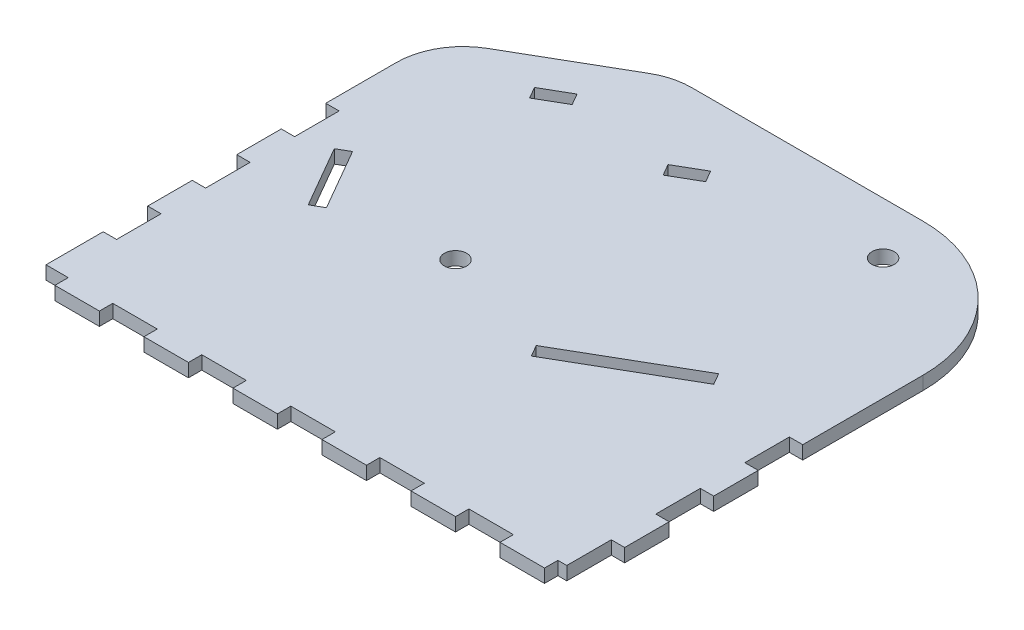
from build123d import *

# Parameters (mm, degrees)
CROQUIS1_R              = 2.5
SALIENTE_EXTRUIR1_DEPTH = 3


with BuildPart() as part:
    # Croquis1 → Saliente-Extruir1 (new body)
    with BuildSketch(Plane(origin=(0, 0, 0), x_dir=(1, 0, 0), z_dir=(0, 1, 0))):
        with BuildLine():
            Line((5, 3), (5, 0))
            Line((5, 0), (15, 0))
            Line((15, 0), (15, 3))
            Line((15, 3), (25, 3))
            Line((25, 3), (25, 0))
            Line((25, 0), (35, 0))
            Line((35, 0), (35, 3))
            Line((35, 3), (45, 3))
            Line((45, 3), (45, 0))
            Line((45, 0), (55, 0))
            Line((55, 0), (55, 3))
            Line((55, 3), (60, 3))
            Line((60, 3), (65, 3))
            Line((65, 3), (65, 0))
            Line((65, 0), (75, 0))
            Line((75, 0), (75, 3))
            Line((75, 3), (85, 3))
            Line((85, 3), (85, 0))
            Line((85, 0), (92.72, 0))
            Line((92.72, 0), (95, 0))
            Line((95, 0), (95, 3))
            Line((95, 3), (105, 3))
            Line((105, 3), (105, 0))
            Line((105, 0), (115, 0))
            Line((115, 0), (115, 3))
            Line((115, 3), (117, 3))
            Line((117, 3), (117, 13))
            Line((117, 13), (120, 13))
            Line((120, 13), (120, 23))
            Line((120, 23), (117, 23))
            Line((117, 23), (117, 33))
            Line((117, 33), (120, 33))
            Line((120, 33), (120, 43))
            Line((120, 43), (117, 43))
            Line((117, 43), (117, 53))
            Line((117, 53), (120, 53))
            Line((120, 53), (120, 80))
            ThreePointArc((120, 80), (111.213203436, 101.213203436), (90, 110))
            Line((90, 110), (38.022727339, 110))
            ThreePointArc((38.022727339, 110), (34.140441662, 109.488887394), (30.522727339, 107.990381057))
            Line((30.522727339, 107.990381057), (7.5, 94.69820323))
            ThreePointArc((7.5, 94.69820323), (2.009618943, 89.207822174), (0, 81.707822174))
            Line((0, 81.707822174), (0, 65.853911087))
            Line((0, 65.853911087), (3, 65.853911087))
            Line((3, 65.853911087), (3, 55.853911087))
            Line((3, 55.853911087), (0, 55.853911087))
            Line((0, 55.853911087), (0, 45.853911087))
            Line((0, 45.853911087), (3, 45.853911087))
            Line((3, 45.853911087), (3, 40.853911087))
            Line((3, 40.853911087), (3, 35.853911087))
            Line((3, 35.853911087), (0, 35.853911087))
            Line((0, 35.853911087), (0, 25.853911087))
            Line((0, 25.853911087), (3, 25.853911087))
            Line((3, 25.853911087), (3, 15.853911087))
            Line((3, 15.853911087), (0, 15.853911087))
            Line((0, 15.853911087), (0, 3))
            Line((0, 3), (5, 3))
        make_face()
        Polygon((12.398076211, 59.469872981), (16.398076211, 52.541669751), (20.398076211, 45.613466521), (17.8, 44.113466521), (9.8, 57.969872981), align=None, mode=Mode.SUBTRACT)
        with Locations((45, 50)):
            Circle(CROQUIS1_R, mode=Mode.SUBTRACT)
        Polygon((70.776406461, 42.36), (83.766787517, 49.86), (96.757168574, 57.36), (98.257168574, 54.761923789), (85.266787517, 47.261923789), (72.276406461, 39.761923789), align=None, mode=Mode.SUBTRACT)
        Polygon((20.374101615, 92.368076211), (23.405190528, 94.118076211), (26.436279442, 95.868076211), (27.936279442, 93.27), (24.905190528, 91.52), (21.874101615, 89.77), align=None, mode=Mode.SUBTRACT)
        Polygon((53.405190528, 94.118076211), (56.436279442, 95.868076211), (57.936279442, 93.27), (54.905190528, 91.52), (51.874101615, 89.77), (50.374101615, 92.368076211), align=None, mode=Mode.SUBTRACT)
        with Locations((92.72, 98.34)):
            Circle(CROQUIS1_R, mode=Mode.SUBTRACT)
    extrude(amount=SALIENTE_EXTRUIR1_DEPTH)


solid = part.part
